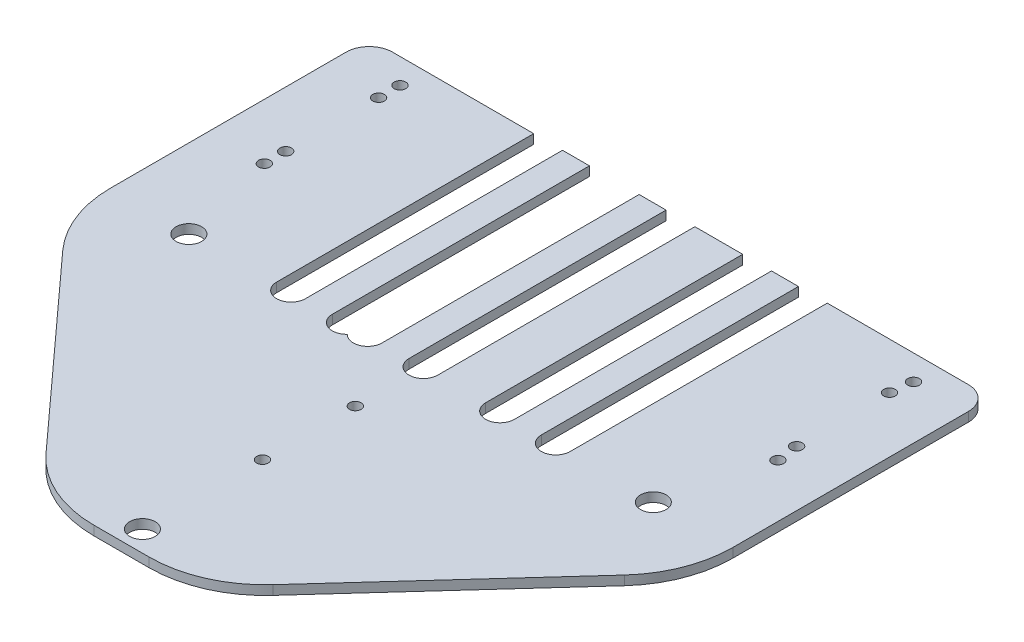
from build123d import *

# Parameters (mm, degrees)
SKETCH1_W                  = 134
SKETCH1_H                  = 120.35
BOSS_EXTRUDE1_DEPTH        = 2
CUT_EXTRUDE1_DEPTH         = 181.122520802
CUT_EXTRUDE2_DEPTH         = 181.122520802
LINEAR_BEARING_D           = 2.5
BELT_HOLDERS_D             = 2.5
CUT_EXTRUDE3_DEPTH         = 181.122520802
FILLET1_R                  = 5
FILLET2_R                  = 25
F_5_5_5_5_DIAMETER_HOLE1_D = 5.5


with BuildPart() as part:
    # Sketch1 → Boss-Extrude1 (new body)
    with BuildSketch(Plane(origin=(0, 0, 0), x_dir=(1, 0, 0), z_dir=(0, 1, 0))):
        with Locations((67, 60.175)):
            Rectangle(SKETCH1_W, SKETCH1_H)
    extrude(amount=BOSS_EXTRUDE1_DEPTH)

    # Sketch3 → Cut-Extrude1 (cut, through all)
    with BuildSketch(Plane(origin=(0, 2, 0), x_dir=(1, 0, 0), z_dir=(0, 1, 0))):
        with BuildLine():
            Line((86.6, 120.35), (86.6, 65))
            ThreePointArc((86.6, 65), (83.5, 61.9), (80.4, 65))
            Line((80.4, 65), (80.4, 120.35))
            Line((80.4, 120.35), (86.6, 120.35))
        make_face()
        with BuildLine():
            Line((70.1, 120.35), (70.1, 65))
            ThreePointArc((70.1, 65), (67, 61.9), (63.9, 65))
            Line((63.9, 65), (63.9, 120.35))
            Line((63.9, 120.35), (70.1, 120.35))
        make_face()
        with BuildLine():
            Line((98.6, 120.35), (98.6, 65))
            ThreePointArc((98.6, 65), (95.5, 61.9), (92.4, 65))
            Line((92.4, 65), (92.4, 120.35))
            Line((92.4, 120.35), (98.6, 120.35))
        make_face()
        with BuildLine():
            Line((58.1, 120.35), (58.1, 65))
            ThreePointArc((58.1, 65), (55, 61.9), (51.9, 65))
            Line((51.9, 65), (51.9, 120.35))
            Line((51.9, 120.35), (58.1, 120.35))
        make_face()
        with BuildLine():
            Line((41.6, 120.35), (41.6, 65))
            ThreePointArc((41.6, 65), (38.5, 61.9), (35.4, 65))
            Line((35.4, 65), (35.4, 120.35))
            Line((35.4, 120.35), (41.6, 120.35))
        make_face()
    extrude(amount=-CUT_EXTRUDE1_DEPTH, mode=Mode.SUBTRACT)

    # Sketch4 → Cut-Extrude2 (cut, through all)
    with BuildSketch(Plane(origin=(0, 2, 0), x_dir=(1, 0, 0), z_dir=(0, 1, 0))):
        with BuildLine():
            Line((47.4, 120.35), (53.6, 120.35))
            Line((53.6, 120.35), (53.6, 65))
            ThreePointArc((53.6, 65), (50.5, 61.9), (47.4, 65))
            Line((47.4, 65), (47.4, 120.35))
        make_face()
    extrude(amount=-CUT_EXTRUDE2_DEPTH, mode=Mode.SUBTRACT)

    # linear bearing (through all)
    with Locations(Plane(origin=(0, 2, 0), x_dir=(1, 0, 0), z_dir=(0, 1, 0))):
        with Locations((12, 110.35), (12, 90.35), (122, 110.35), (122, 90.35), (67, 50.35), (67, 30.35)):
            Hole(LINEAR_BEARING_D / 2)

    # belt holders (through all)
    with Locations(Plane(origin=(0, 2, 0), x_dir=(1, 0, 0), z_dir=(0, 1, 0))):
        with Locations((12, 114.95), (12, 85.75), (122.58126033, 85.75), (122.58126033, 114.95)):
            Hole(BELT_HOLDERS_D / 2)

    # Sketch9 → Cut-Extrude3 (cut, through all)
    with BuildSketch(Plane(origin=(0, 2, 0), x_dir=(1, 0, 0), z_dir=(0, 1, 0))):
        Polygon((0, 55), (50, 0), (0, 0), align=None)
        Polygon((134, 0), (134, 55), (84, 0), align=None)
    extrude(amount=-CUT_EXTRUDE3_DEPTH, mode=Mode.SUBTRACT)

    # Fillet1
    fillet1_edges = [part.edges().sort_by_distance(p)[0] for p in [
        (134, 1, -120.35),
        (0, 1, -120.35),
    ]]
    fillet(fillet1_edges, radius=FILLET1_R)

    # Fillet2
    fillet2_edges = [part.edges().sort_by_distance(p)[0] for p in [
        (134, 1, -55),
        (84, 1, 0),
        (50, 1, 0),
        (0, 1, -55),
    ]]
    fillet(fillet2_edges, radius=FILLET2_R)

    # Ø5.5 (5.5) Diameter Hole1 (through all)
    with Locations(Plane(origin=(0, 2, 0), x_dir=(1, 0, 0), z_dir=(0, 1, 0))):
        with Locations((67, 4.5), (117, 64.5), (17, 64.5)):
            Hole(F_5_5_5_5_DIAMETER_HOLE1_D / 2)


solid = part.part
